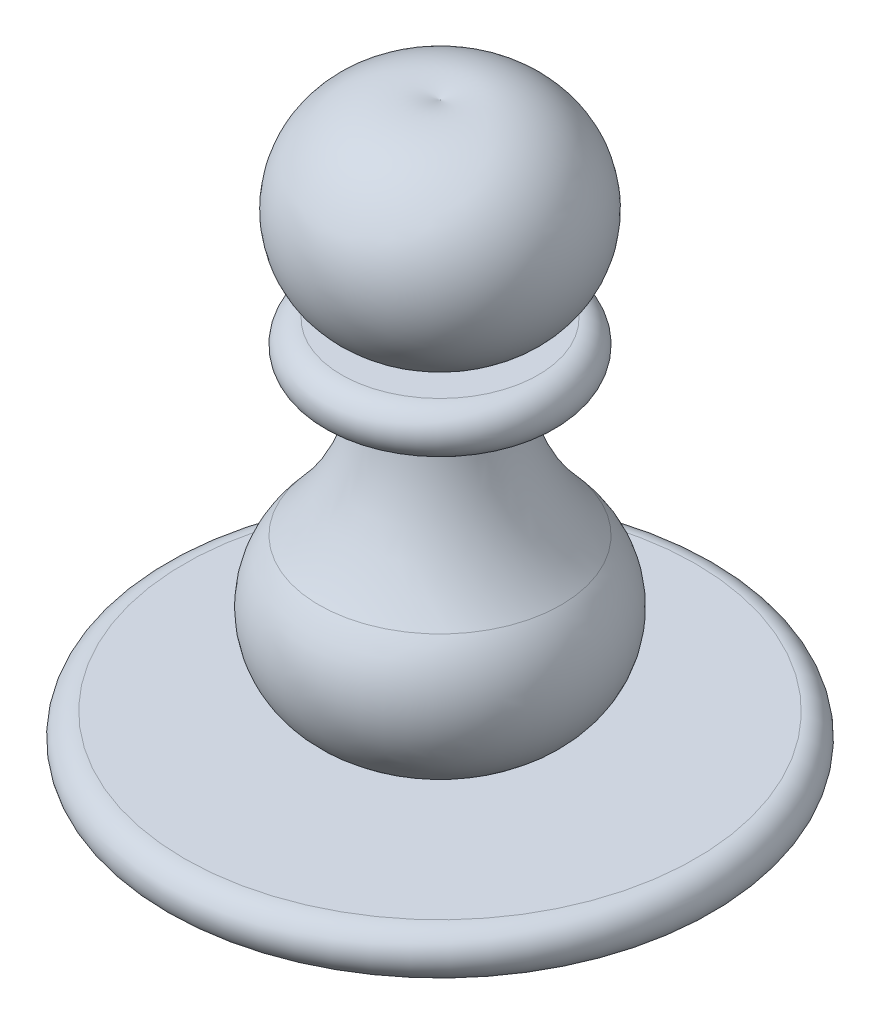
from build123d import *

# Parameters (mm, degrees)
SKETCH3_R           = 18.394097112
BOSS_EXTRUDE3_DEPTH = 3
FILLET12_R          = 1.5
SKETCH4_W           = 4
SKETCH4_H           = 19.5
SKETCH5_R           = 8
BOSS_EXTRUDE4_DEPTH = 3
FILLET13_R          = 1.5


with BuildPart() as part:
    # Sketch3 → Boss-Extrude3 (new body)
    with BuildSketch(Plane(origin=(0, 0, 0), x_dir=(1, 0, 0), z_dir=(0, 1, 0))):
        with Locations(Location((0, 0, 0), (0, 0, 270))):
            Circle(SKETCH3_R)
    extrude(amount=BOSS_EXTRUDE3_DEPTH)

    # Fillet12
    fillet12_edges = [part.edges().sort_by_distance(p)[0] for p in [
        (0, 0, -18.394097112),
        (0, 3, -18.394097112),
    ]]
    fillet(fillet12_edges, radius=FILLET12_R - 0.0001)  # a hair under: the kernel refuses the full size

    # Sketch4 → Revolve2 (revolve)
    with BuildSketch(Plane.XY, mode=Mode.PRIVATE) as revolve2_sk:
        with BuildLine():
            ThreePointArc((-8, 13.07553471), (-5.171037359, 17.435933011), (-4, 22.5))
            Line((-4, 22.5), (-4, 3))
            ThreePointArc((-4, 3), (-9.185069443, 6.773290765), (-8, 13.07553471))
        make_face()
        with Locations((-2, 12.75)):
            Rectangle(SKETCH4_W, SKETCH4_H)
    revolve(revolve2_sk.sketch.rotate(Axis((0, -279.913753281, 0), (0, 1, 0)), 180), axis=Axis((0, -279.913753281, 0), (0, 1, 0)))

    # Sketch5 → Boss-Extrude4 (add)
    with BuildSketch(Plane(origin=(0, 22.5, 0), x_dir=(1, 0, 0), z_dir=(0, 1, 0))):
        with Locations(Location((0, 0, 0), (0, 0, 180))):
            Circle(SKETCH5_R)
    extrude(amount=BOSS_EXTRUDE4_DEPTH)

    # Fillet13
    fillet13_edges = [part.edges().sort_by_distance(p)[0] for p in [
        (8, 22.5, 0),
        (8, 25.5, 0),
    ]]
    fillet(fillet13_edges, radius=FILLET13_R - 0.0001)  # a hair under: the kernel refuses the full size

    # Sketch6 → Revolve3 (revolve)
    with BuildSketch(Plane.XY):
        with BuildLine():
            Line((0, 25.5), (1e-09, 38))
            ThreePointArc((1e-09, 38), (-8.433746623, 31.75), (0, 25.5))
        make_face()
    revolve(axis=Axis((0, -279.913753281, 0), (0, 1, 0)))


solid = part.part
